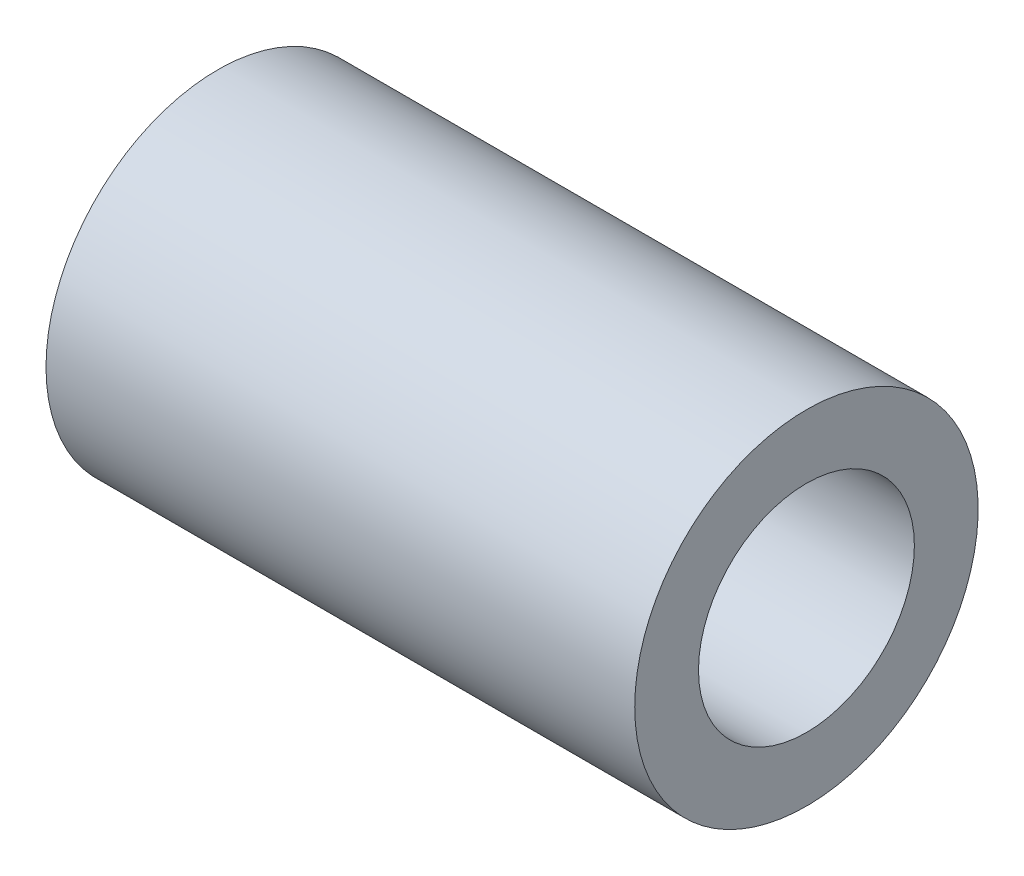
from build123d import *

# Parameters (mm, degrees)
SKETCH1_R           = 4.445
SKETCH1_R_2         = 2.794
BOSS_EXTRUDE1_DEPTH = 15.24


with BuildPart() as part:
    # Sketch1 → Boss-Extrude1 (new body)
    with BuildSketch(Plane(origin=(0, 0, 0), x_dir=(0, 0, -1), z_dir=(1, 0, 0))):
        Circle(SKETCH1_R)
        Circle(SKETCH1_R_2, mode=Mode.SUBTRACT)
    extrude(amount=BOSS_EXTRUDE1_DEPTH)


solid = part.part
